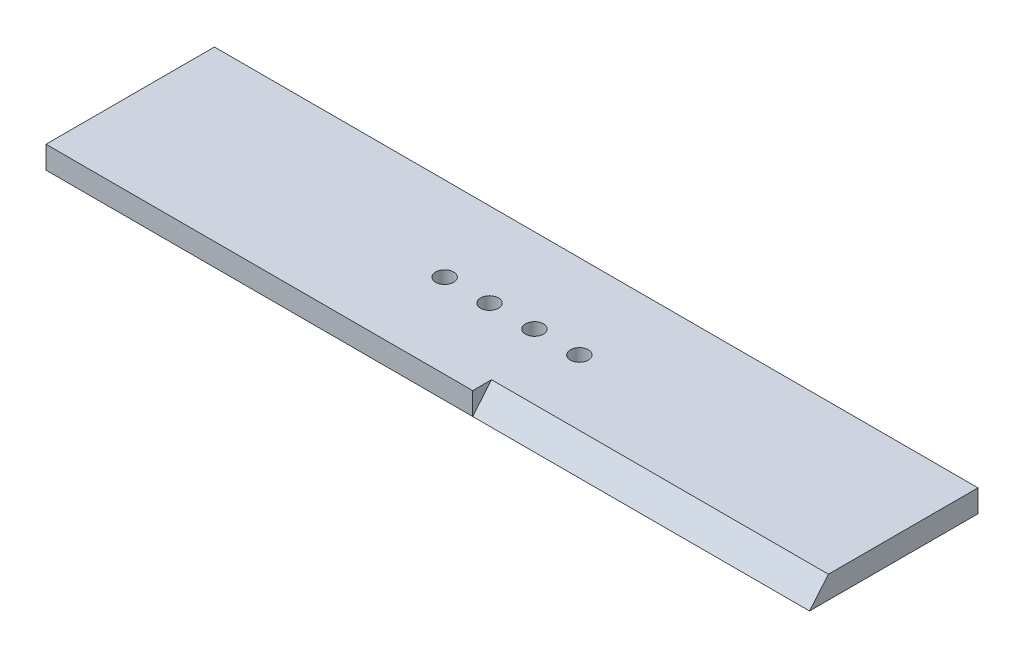
from build123d import *

# Parameters (mm, degrees)
SKETCH1_W             = 340
SKETCH1_H             = 75
BOSS_EXTRUDE2_DEPTH   = 5
F_8_0MM_DOWEL_HOLE1_D = 8
CUT_EXTRUDE3_DEPTH    = 150
CUT_EXTRUDE4_DEPTH    = 150


with BuildPart() as part:
    # Sketch1 → Boss-Extrude2 (new, symmetric)
    with BuildSketch(Plane(origin=(0, 0, 0), x_dir=(1, 0, 0), z_dir=(0, 1, 0))):
        Rectangle(SKETCH1_W, SKETCH1_H)
    extrude(amount=BOSS_EXTRUDE2_DEPTH, both=True)

    # Ø8.0mm Dowel Hole1 (through all)
    with Locations(Plane(origin=(0, 5, 0), x_dir=(1, 0, 0), z_dir=(0, 1, 0))):
        with Locations((10, 0), (30, 0), (-10, 0), (-30, 0)):
            Hole(F_8_0MM_DOWEL_HOLE1_D / 2)

    # Sketch10 → Cut-Extrude3 (cut)
    with BuildSketch(Plane(origin=(170, 0, 0), x_dir=(0, 0, -1), z_dir=(1, 0, 0))):
        Polygon((-37.5, 5), (-37.5, -5), (-29.109003688, 5), align=None)
    extrude(amount=-CUT_EXTRUDE3_DEPTH, mode=Mode.SUBTRACT)

    # Sketch11 → Cut-Extrude4 (cut)
    with BuildSketch(Plane.ZY.offset(170)):
        Polygon((-37.5, 5), (-37.5, -5), (-29.109003688, -5), align=None)
    extrude(amount=-CUT_EXTRUDE4_DEPTH, mode=Mode.SUBTRACT)


solid = part.part
